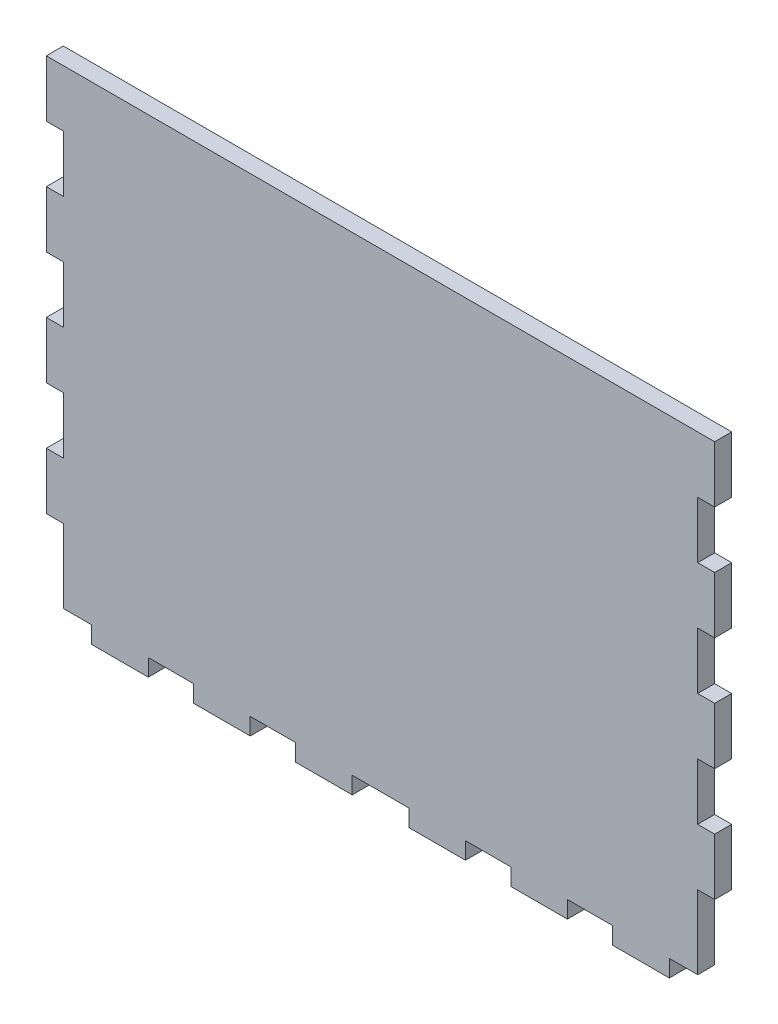
from build123d import *

# Parameters (mm, degrees)
BOSS_EXTRUDE1_DEPTH = 3


with BuildPart() as part:
    # Sketch1 → Boss-Extrude1 (new body)
    with BuildSketch(Plane.XY):
        Polygon((-56, -12.5), (-56, -25.5), (-51, -25.5), (-51, -28.5), (-41, -28.5), (-41, -25.5), (-33, -25.5), (-33, -28.5), (-23, -28.5), (-23, -25.5), (-15, -25.5), (-15, -28.5), (-5, -28.5), (-5, -25.5), (5, -25.5), (5, -28.5), (15, -28.5), (15, -25.5), (23, -25.5), (23, -28.5), (33, -28.5), (33, -25.5), (41, -25.5), (41, -28.5), (51, -28.5), (51, -25.5), (56, -25.5), (56, -12.5), (59, -12.5), (59, -2.5), (56, -2.5), (56, 7.5), (59, 7.5), (59, 17.5), (56, 17.5), (56, 27.5), (59, 27.5), (59, 37.5), (56, 37.5), (56, 47.5), (59, 47.5), (59, 57.5), (56, 57.5), (-56, 57.5), (-59, 57.5), (-59, 47.5), (-56, 47.5), (-56, 37.5), (-59, 37.5), (-59, 27.5), (-56, 27.5), (-56, 17.5), (-59, 17.5), (-59, 7.5), (-56, 7.5), (-56, -2.5), (-59, -2.5), (-59, -12.5), align=None)
    extrude(amount=BOSS_EXTRUDE1_DEPTH)


solid = part.part
